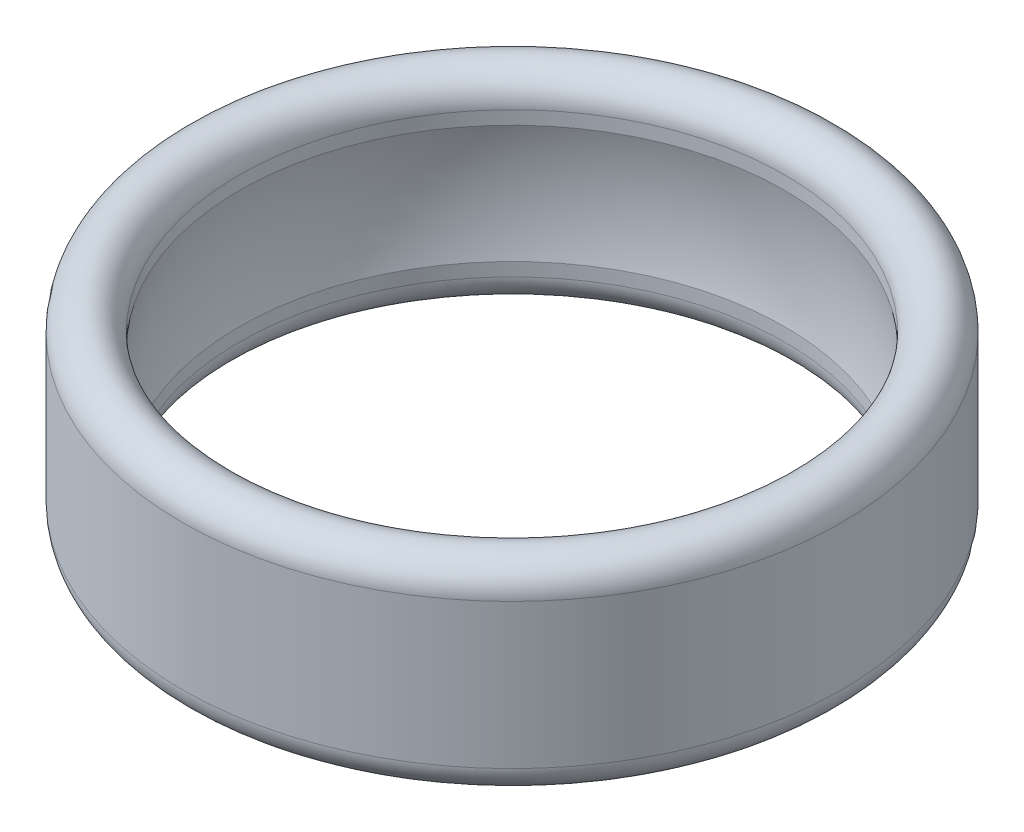
from build123d import *

# Parameters (mm, degrees)
SKETCH2_R           = 6.477
BOSS_EXTRUDE1_DEPTH = 3.9624
SKETCH3_R           = 5.3594
CUT_EXTRUDE1_DEPTH  = 3.9624
FILLET1_R           = 0.5588
FILLET2_R           = 0.5588


with BuildPart() as part:
    # Sketch2 → Boss-Extrude1 (new body)
    with BuildSketch(Plane(origin=(0, 0, 0), x_dir=(1, 0, 0), z_dir=(0, 1, 0))):
        with Locations(Location((0, 0, 0), (0, 0, 270))):
            Circle(SKETCH2_R)
    extrude(amount=BOSS_EXTRUDE1_DEPTH)

    # Sketch3 → Cut-Extrude1 (cut)
    with BuildSketch(Plane(origin=(0, 3.9624, 0), x_dir=(1, 0, 0), z_dir=(0, 1, 0))):
        with Locations(Location((0, 0, 0), (0, 0, 270))):
            Circle(SKETCH3_R)
    extrude(amount=-CUT_EXTRUDE1_DEPTH, mode=Mode.SUBTRACT)

    # Fillet1
    fillet1_edges = [part.edges().sort_by_distance(p)[0] for p in [
        (0, 3.9624, -6.477),
        (0, 3.9624, -5.3594),
    ]]
    fillet(fillet1_edges, radius=FILLET1_R - 0.0001)  # a hair under: the kernel refuses the full size

    # Fillet2
    fillet2_edges = [part.edges().sort_by_distance(p)[0] for p in [
        (0, 0, -6.477),
        (0, 0, -5.3594),
    ]]
    fillet(fillet2_edges, radius=FILLET2_R - 0.0001)  # a hair under: the kernel refuses the full size

    # Sketch5 → Cut-Revolve3 (revolve, cut)
    with BuildSketch(Plane.XY, mode=Mode.PRIVATE) as cut_revolve3_sk:
        with BuildLine():
            Line((-5.106760528, 3.9624), (-5.106760528, 0))
            ThreePointArc((-5.106760528, 0), (-5.4864, 1.9812), (-5.106760528, 3.9624))
        make_face()
    revolve(cut_revolve3_sk.sketch.rotate(Axis((0, 0, 0), (0, -1, 0)), 270), axis=Axis((0, 0, 0), (0, -1, 0)), mode=Mode.SUBTRACT)


solid = part.part
